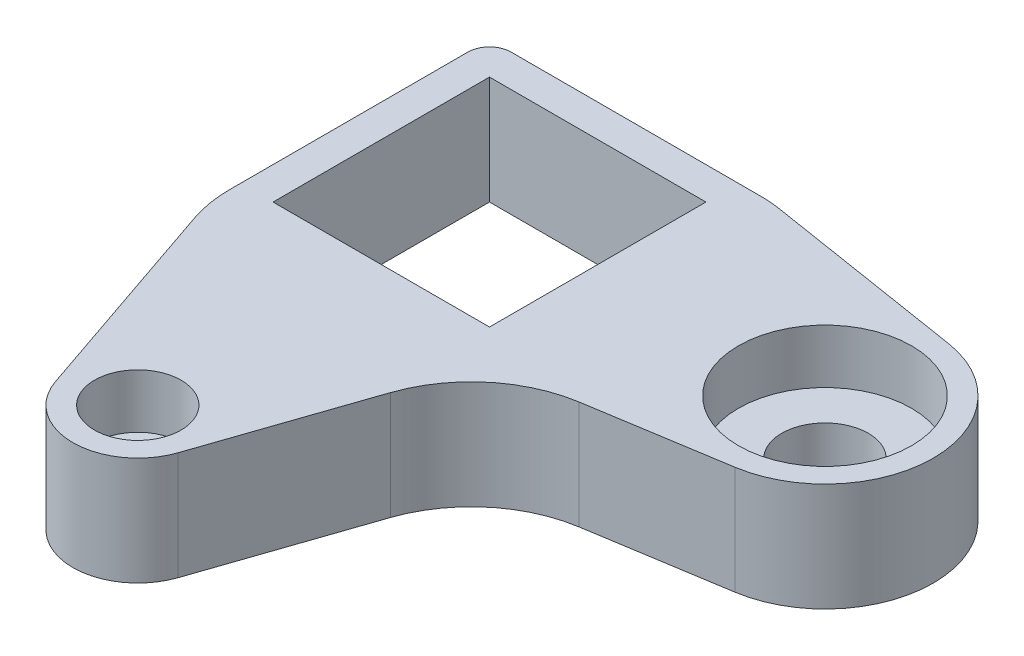
from build123d import *

# Parameters (mm, degrees)
SKETCH1_W           = 20
SKETCH1_H           = 20
BOSS_EXTRUDE1_DEPTH = 10
SKETCH2_R           = 4
CUT_EXTRUDE2_DEPTH  = 68
SKETCH3_R           = 4
SKETCH3_R_2         = 8
CUT_EXTRUDE3_DEPTH  = 70


with BuildPart() as part:
    # Sketch1 → Boss-Extrude1 (new body)
    with BuildSketch(Plane(origin=(0, 0, 0), x_dir=(1, 0, 0), z_dir=(0, 1, 0))):
        with BuildLine():
            Line((23.939871077, 2.849965846), (42.576368333, -0.125028462))
            ThreePointArc((42.576368333, -0.125028462), (51, -10), (42.576368333, -19.874971538))
            Line((42.576368333, -19.874971538), (30.130588759, -21.86172489))
            ThreePointArc((30.130588759, -21.86172489), (24.291669579, -24.533541475), (20.666245259, -29.833341429))
            Line((20.666245259, -29.833341429), (15.677992749, -44.439174654))
            ThreePointArc((15.677992749, -44.439174654), (10, -48.5), (4.322007251, -44.439174654))
            Line((4.322007251, -44.439174654), (-2.355985499, -24.885704137))
            ThreePointArc((-2.355985499, -24.885704137), (-2.837901545, -22.973082941), (-3, -21.00735483))
            Line((-3, -21.00735483), (-3, 1))
            ThreePointArc((-3, 1), (-2.414213562, 2.414213562), (-1, 3))
            Line((-1, 3), (22.048229077, 3))
            ThreePointArc((22.048229077, 3), (22.997020375, 2.962432657), (23.939871077, 2.849965846))
        make_face()
        with Locations((10, -10)):
            Rectangle(SKETCH1_W, SKETCH1_H, mode=Mode.SUBTRACT)
    extrude(amount=BOSS_EXTRUDE1_DEPTH)

    # Sketch2 → Cut-Extrude2 (cut)
    with BuildSketch(Plane(origin=(0, 5, 0), x_dir=(1, 0, 0), z_dir=(0, 1, 0))):
        with Locations((41, -10)):
            Circle(SKETCH2_R)
    extrude(amount=-CUT_EXTRUDE2_DEPTH, mode=Mode.SUBTRACT)

    # Sketch3 → Cut-Extrude3 (cut)
    with BuildSketch(Plane(origin=(0, 5, 0), x_dir=(1, 0, 0), z_dir=(0, 1, 0))):
        with Locations((10, -42.5)):
            Circle(SKETCH3_R)
        with Locations((41, -10)):
            Circle(SKETCH3_R_2)
    extrude(amount=CUT_EXTRUDE3_DEPTH, mode=Mode.SUBTRACT)


solid = part.part
